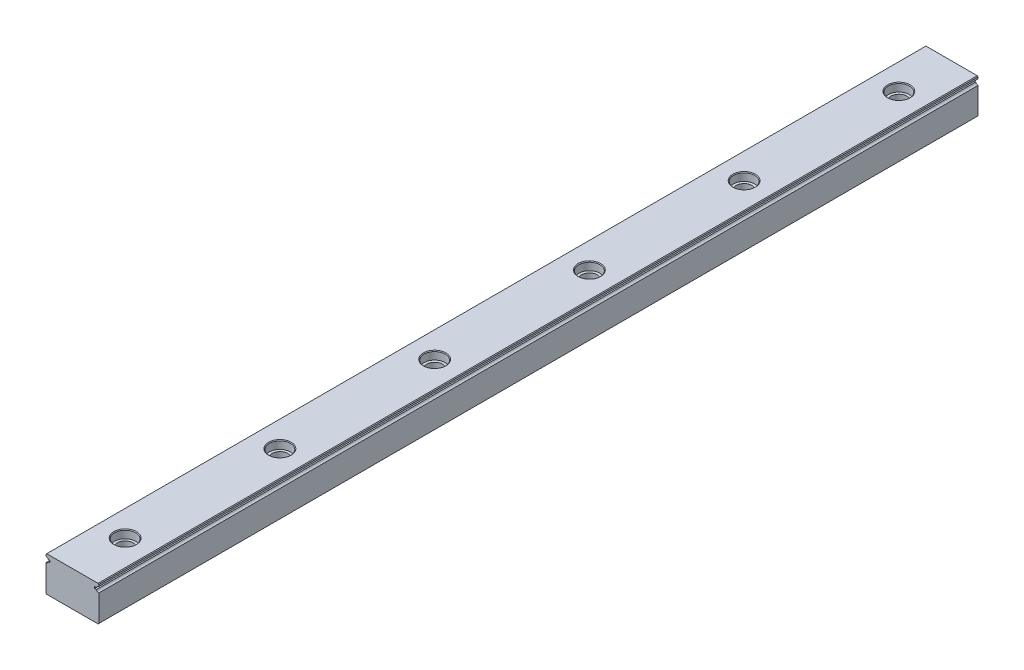
from build123d import *

# Parameters (mm, degrees)
EXTRUDE1_DEPTH             = 250
EXTRUDE2_REACH             = 252.312
SKETCH2_R                  = 2.25
SKETCH_R                   = 3
SKETCH_R_2                 = 2.25
EXTRUDE4_DEPTH             = 2.3
CHAMFER1_SIZE              = 0.2
LPATTERN1_COUNT            = 6
LPATTERN1_PITCH            = 44
CHAMFER1_OF_LPATTERN1_SIZE = 0.2


with BuildPart() as part:
    # Sketch1 → Extrude1 (new body)
    with BuildSketch(Plane.XY):
        with BuildLine():
            Line((-7.3, -5), (7.3, -5))
            Line((7.3, -5), (7.5, -4.8))
            Line((7.5, -4.8), (7.5, 2.706274607))
            ThreePointArc((7.5, 2.706274607), (7.091294745, 2.882570681), (6.840065792, 3.25))
            Line((6.840065792, 3.25), (6.340065792, 3.25))
            Line((6.340065792, 3.25), (6.340065792, 3.75))
            Line((6.340065792, 3.75), (6.840065792, 3.75))
            ThreePointArc((6.840065792, 3.75), (7.091294745, 4.117429319), (7.5, 4.293725393))
            Line((7.5, 4.293725393), (7.5, 4.8))
            Line((7.5, 4.8), (7.3, 5))
            Line((7.3, 5), (-7.3, 5))
            Line((-7.3, 5), (-7.5, 4.8))
            Line((-7.5, 4.8), (-7.5, 4.293725393))
            ThreePointArc((-7.5, 4.293725393), (-7.091294745, 4.117429319), (-6.840065792, 3.75))
            Line((-6.840065792, 3.75), (-6.340065792, 3.75))
            Line((-6.340065792, 3.75), (-6.340065792, 3.25))
            Line((-6.340065792, 3.25), (-6.840065792, 3.25))
            ThreePointArc((-6.840065792, 3.25), (-7.091294745, 2.882570681), (-7.5, 2.706274607))
            Line((-7.5, 2.706274607), (-7.5, -4.8))
            Line((-7.5, -4.8), (-7.3, -5))
        make_face()
    extrude(amount=EXTRUDE1_DEPTH)

    # Sketch2 → Extrude2 (cut, up to next)
    with BuildSketch(Plane(origin=(0, 5, 0), x_dir=(1, 0, 0), z_dir=(0, 1, 0)), mode=Mode.PRIVATE) as extrude2_sk1:
        with Locations((0, -15)):
            Circle(SKETCH2_R)
    extrude2_tool1 = extrude(extrude2_sk1.sketch, amount=-EXTRUDE2_REACH, mode=Mode.PRIVATE) & part.part
    extrude2 = extrude2_tool1.solids().sort_by_distance((0, 5, 15))[0]
    add(extrude2, mode=Mode.SUBTRACT)

    # Sketch → Extrude4 (cut)
    with BuildSketch(Plane(origin=(0, 5, 0), x_dir=(1, 0, 0), z_dir=(0, 1, 0))):
        with Locations((0, -15)):
            Circle(SKETCH_R)
        with Locations((0, -15)):
            Circle(SKETCH_R_2, mode=Mode.SUBTRACT)
    extrude4 = extrude(amount=-EXTRUDE4_DEPTH, mode=Mode.SUBTRACT)

    # Chamfer1
    chamfer1_edges = [part.edges().sort_by_distance(p)[0] for p in [
        (-2.25, -5, 15),
        (-3, 5, 15),
    ]]
    chamfer(chamfer1_edges, length=CHAMFER1_SIZE)

    # LPattern1: Extrude2, Extrude4 ×6
    with Locations(*[(0, 0, i * LPATTERN1_PITCH) for i in range(1, LPATTERN1_COUNT)]):
        add(extrude2, mode=Mode.SUBTRACT)
        add(extrude4, mode=Mode.SUBTRACT)

    # Chamfer1 of LPattern1
    chamfer1_of_lpattern1_edges = [part.edges().sort_by_distance(p)[0] for p in [
        (-2.25, -5, 59),
        (-3, 5, 59),
        (-2.25, -5, 103),
        (-3, 5, 103),
        (-2.25, -5, 147),
        (-3, 5, 147),
        (-2.25, -5, 191),
        (-3, 5, 191),
        (-2.25, -5, 235),
        (-3, 5, 235),
    ]]
    chamfer(chamfer1_of_lpattern1_edges, length=CHAMFER1_OF_LPATTERN1_SIZE)


solid = part.part
